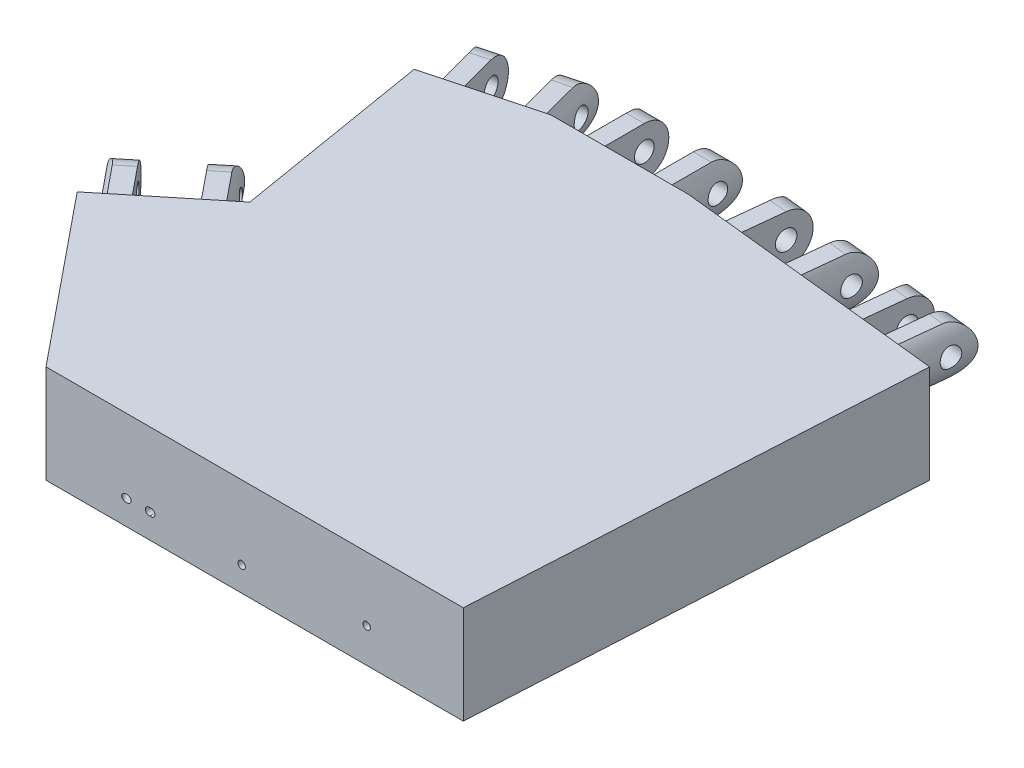
from build123d import *

# Parameters (mm, degrees)
BOSS_EXTRUDE1_DEPTH                 = 20
SKETCH2_W                           = 3.660254038
SKETCH2_H                           = 10
BOSS_EXTRUDE2_DEPTH                 = 15
CUT_EXTRUDE1_DEPTH                  = 114.0214199
CUT_EXTRUDE1_DEPTH_BACK             = 114.0214199
SKETCH3_R                           = 2
SKETCH7_W                           = 3.660254038
SKETCH7_H                           = 10
BOSS_EXTRUDE4_DEPTH                 = 15
CUT_EXTRUDE4_REACH                  = 103.066
CUT_EXTRUDE4_END_RADIUS             = 10
SKETCH8_R                           = 2
CUT_EXTRUDE4_DIRECTION_2_REACH      = 103.066
CUT_EXTRUDE4_DIRECTION_2_END_RADIUS = 10
SKETCH4_W                           = 3.660254038
SKETCH4_H                           = 10
SKETCH4_W_2                         = 3.090169943
SKETCH4_W_3                         = 3.090169944
BOSS_EXTRUDE3_DEPTH                 = 15
CUT_EXTRUDE3_START                  = -5
SKETCH6_R                           = 2
CUT_EXTRUDE3_DEPTH                  = 42.812004
SKETCH2_3_R                         = 0.75
CUT_EXTRUDE5_DEPTH                  = 123.192220688
SKETCH4_4_R                         = 0.75
CUT_EXTRUDE6_DEPTH                  = 115.031526432
SKETCH7_4_R                         = 0.75
CUT_EXTRUDE7_DEPTH                  = 113.041561779
BOSS_EXTRUDE5_DEPTH                 = 20
SKETCH10_W                          = 3.660254038
SKETCH10_H                          = 10
BOSS_EXTRUDE6_DEPTH                 = 15
SKETCH11_R                          = 2
CUT_EXTRUDE8_DEPTH                  = 7.707578
CUT_EXTRUDE8_DIRECTION_2_REACH      = 136.78
CUT_EXTRUDE8_DIRECTION_2_END_RADIUS = 10
SKETCH10_6_R                        = 0.75
CUT_EXTRUDE9_DEPTH                  = 104.391697718
CHAMFER1_SIZE                       = 2


with BuildPart() as part:
    # Sketch1 → Boss-Extrude1 (new body)
    with BuildSketch(Plane(origin=(0, 0, 0), x_dir=(1, 0, 0), z_dir=(0, 1, 0))):
        Polygon((-30.5, 50.866666667), (-52.5, 45), (-37.5, -45), (47.5, -45), (52.5, 45), (-2.5, 50.866666667), align=None)
    extrude(amount=BOSS_EXTRUDE1_DEPTH)

    # Sketch2 → Boss-Extrude2 (add)
    with BuildSketch(Plane(origin=(-14.68879668, 0, -55.082987552), x_dir=(-0.9662349396012465, 0, 0.25766265056033155), z_dir=(-0.25766265056033155, 0, -0.9662349396012465))):
        with Locations((20.302388035, 13)):
            Rectangle(SKETCH2_W, SKETCH2_H)
        with BuildLine():
            Line((18.472261016, 8), (18.472261016, 18))
            ThreePointArc((18.472261016, 18), (17.132515054, 13), (18.472261016, 8))
        make_face()
        with Locations((33.962642073, 13)):
            Rectangle(SKETCH2_W, SKETCH2_H)
        with BuildLine():
            ThreePointArc((37.132515054, 13), (36.791773317, 15.588190451), (35.792769092, 18))
            Line((35.792769092, 18), (35.792769092, 8))
            ThreePointArc((35.792769092, 8), (36.791773317, 10.411809549), (37.132515054, 13))
        make_face()
    extrude(amount=BOSS_EXTRUDE2_DEPTH)

    # Sketch3 → Cut-Extrude1 (cut, two sides: drawn at the far end of the back side and taken through both)
    with BuildSketch(Plane(origin=(-31.047558742, 0, 8.279348998), x_dir=(-0.25766265056033155, 0, -0.9662349396012465), z_dir=(0.9662349396012465, 0, -0.25766265056033155)).offset(-CUT_EXTRUDE1_DEPTH_BACK)):
        with BuildLine():
            Line((72.007861436, 18), (67.007861436, 18))
            ThreePointArc((67.007861436, 18), (70.543395342, 16.535533906), (72.007861436, 13))
            Line((72.007861436, 13), (72.007861436, 18))
        make_face()
        with BuildLine():
            Line((72.007861436, 8), (72.007861436, 13))
            ThreePointArc((72.007861436, 13), (70.543395342, 9.464466094), (67.007861436, 8))
            Line((67.007861436, 8), (72.007861436, 8))
        make_face()
        with Locations((67.007861436, 13)):
            Circle(SKETCH3_R)
    extrude(amount=CUT_EXTRUDE1_DEPTH + CUT_EXTRUDE1_DEPTH_BACK, mode=Mode.SUBTRACT)

    # Sketch7 → Boss-Extrude4 (add)
    with BuildSketch(Plane(origin=(0, 0, -50.866666667), x_dir=(-1, 0, 0), z_dir=(0, 0, -1))):
        with Locations((23.330127019, 13)):
            Rectangle(SKETCH7_W, SKETCH7_H)
        with Locations((9.669872981, 13)):
            Rectangle(SKETCH7_W, SKETCH7_H)
        with BuildLine():
            Line((7.839745962, 8), (7.839745962, 18))
            ThreePointArc((7.839745962, 18), (6.5, 13), (7.839745962, 8))
        make_face()
        with BuildLine():
            ThreePointArc((26.5, 13), (26.159258263, 15.588190451), (25.160254038, 18))
            Line((25.160254038, 18), (25.160254038, 8))
            ThreePointArc((25.160254038, 8), (26.159258263, 10.411809549), (26.5, 13))
        make_face()
    extrude(amount=BOSS_EXTRUDE4_DEPTH)

    # Cut-Extrude4: up to this cylinder (the profile starts inside it)
    cut_extrude4_end = Plane(origin=(-16.5, 13, -62.808247), z_dir=(0, 0, 1)) * Cylinder(CUT_EXTRUDE4_END_RADIUS, 231.01516, mode=Mode.PRIVATE)
    # Sketch8 → Cut-Extrude4 (cut, up to the surface)
    with BuildSketch(Plane(origin=(-21.5, 0, 0), x_dir=(0, 0, -1), z_dir=(1, 0, 0)), mode=Mode.PRIVATE) as cut_extrude4_sk1:
        with BuildLine():
            Line((65.866666667, 18), (60.866666667, 18))
            ThreePointArc((60.866666667, 18), (64.402200573, 16.535533906), (65.866666667, 13))
            Line((65.866666667, 13), (65.866666667, 18))
        make_face()
    cut_extrude4_tool1 = extrude(cut_extrude4_sk1.sketch, amount=CUT_EXTRUDE4_REACH, mode=Mode.PRIVATE) & cut_extrude4_end
    add(cut_extrude4_tool1.solids().sort_by_distance((-21.5, 16.88316, -64.749827))[0], mode=Mode.SUBTRACT)
    # Sketch8 → Cut-Extrude4 (cut, up to the surface)
    with BuildSketch(Plane(origin=(-21.5, 0, 0), x_dir=(0, 0, -1), z_dir=(1, 0, 0)), mode=Mode.PRIVATE) as cut_extrude4_sk2:
        with BuildLine():
            Line((65.866666667, 8), (65.866666667, 13))
            ThreePointArc((65.866666667, 13), (64.402200573, 9.464466094), (60.866666667, 8))
            Line((60.866666667, 8), (65.866666667, 8))
        make_face()
    cut_extrude4_tool2 = extrude(cut_extrude4_sk2.sketch, amount=CUT_EXTRUDE4_REACH, mode=Mode.PRIVATE) & cut_extrude4_end
    add(cut_extrude4_tool2.solids().sort_by_distance((-21.5, 9.11684, -64.749827))[0], mode=Mode.SUBTRACT)
    # Sketch8 → Cut-Extrude4 (cut, up to the surface)
    with BuildSketch(Plane(origin=(-21.5, 0, 0), x_dir=(0, 0, -1), z_dir=(1, 0, 0)), mode=Mode.PRIVATE) as cut_extrude4_sk3:
        with Locations(Location((60.866666667, 13, 0), (0, 0, 180))):
            Circle(SKETCH8_R)
    cut_extrude4_tool3 = extrude(cut_extrude4_sk3.sketch, amount=CUT_EXTRUDE4_REACH, mode=Mode.PRIVATE) & cut_extrude4_end
    add(cut_extrude4_tool3.solids().sort_by_distance((-21.5, 13, -60.866667))[0], mode=Mode.SUBTRACT)

    # Cut-Extrude4 direction 2: up to this cylinder (the profile starts inside it)
    cut_extrude4_direction_2_end = Plane(origin=(-16.5, 13, -62.808247), z_dir=(0, 0, 1)) * Cylinder(CUT_EXTRUDE4_DIRECTION_2_END_RADIUS, 231.01516, mode=Mode.PRIVATE)
    # Sketch8 → Cut-Extrude4 direction 2 (cut, up to the surface)
    with BuildSketch(Plane(origin=(-21.5, 0, 0), x_dir=(0, 0, -1), z_dir=(1, 0, 0)), mode=Mode.PRIVATE) as cut_extrude4_direction_2_sk1:
        with BuildLine():
            Line((65.866666667, 18), (60.866666667, 18))
            ThreePointArc((60.866666667, 18), (64.402200573, 16.535533906), (65.866666667, 13))
            Line((65.866666667, 13), (65.866666667, 18))
        make_face()
    cut_extrude4_direction_2_tool1 = extrude(cut_extrude4_direction_2_sk1.sketch, amount=-CUT_EXTRUDE4_DIRECTION_2_REACH, mode=Mode.PRIVATE) & cut_extrude4_direction_2_end
    add(cut_extrude4_direction_2_tool1.solids().sort_by_distance((-21.5, 16.88316, -64.749827))[0], mode=Mode.SUBTRACT)
    # Sketch8 → Cut-Extrude4 direction 2 (cut, up to the surface)
    with BuildSketch(Plane(origin=(-21.5, 0, 0), x_dir=(0, 0, -1), z_dir=(1, 0, 0)), mode=Mode.PRIVATE) as cut_extrude4_direction_2_sk2:
        with BuildLine():
            Line((65.866666667, 8), (65.866666667, 13))
            ThreePointArc((65.866666667, 13), (64.402200573, 9.464466094), (60.866666667, 8))
            Line((60.866666667, 8), (65.866666667, 8))
        make_face()
    cut_extrude4_direction_2_tool2 = extrude(cut_extrude4_direction_2_sk2.sketch, amount=-CUT_EXTRUDE4_DIRECTION_2_REACH, mode=Mode.PRIVATE) & cut_extrude4_direction_2_end
    add(cut_extrude4_direction_2_tool2.solids().sort_by_distance((-21.5, 9.11684, -64.749827))[0], mode=Mode.SUBTRACT)
    # Sketch8 → Cut-Extrude4 direction 2 (cut, up to the surface)
    with BuildSketch(Plane(origin=(-21.5, 0, 0), x_dir=(0, 0, -1), z_dir=(1, 0, 0)), mode=Mode.PRIVATE) as cut_extrude4_direction_2_sk3:
        with Locations(Location((60.866666667, 13, 0), (0, 0, 180))):
            Circle(SKETCH8_R)
    cut_extrude4_direction_2_tool3 = extrude(cut_extrude4_direction_2_sk3.sketch, amount=-CUT_EXTRUDE4_DIRECTION_2_REACH, mode=Mode.PRIVATE) & cut_extrude4_direction_2_end
    add(cut_extrude4_direction_2_tool3.solids().sort_by_distance((-21.5, 13, -60.866667))[0], mode=Mode.SUBTRACT)

    # Sketch4 → Boss-Extrude3 (add)
    with BuildSketch(Plane(origin=(5.336614519, 0, -50.030761118), x_dir=(-0.994359200551929, 0, -0.10606498139220541), z_dir=(0.10606498139220541, 0, -0.994359200551929))):
        with BuildLine():
            ThreePointArc((2.881070055, 13), (2.540328318, 15.588190451), (1.541324093, 18))
            Line((1.541324093, 18), (1.541324093, 8))
            ThreePointArc((1.541324093, 8), (2.540328318, 10.411809549), (2.881070055, 13))
        make_face()
        with Locations((-0.288802926, 13)):
            Rectangle(SKETCH4_W, SKETCH4_H)
        with Locations((-13.949056964, 13)):
            Rectangle(SKETCH4_W, SKETCH4_H)
        with BuildLine():
            Line((-15.779183983, 8), (-15.779183983, 18))
            ThreePointArc((-15.779183983, 18), (-17.118929945, 13), (-15.779183983, 8))
        make_face()
        with Locations((-28.385848895, 13)):
            Rectangle(SKETCH4_W_2, SKETCH4_H)
        with BuildLine():
            ThreePointArc((-24.930933866, 13), (-25.424641174, 15.676165673), (-26.840763923, 18))
            Line((-26.840763923, 18), (-26.840763923, 8))
            ThreePointArc((-26.840763923, 8), (-25.424641174, 10.323834327), (-24.930933866, 13))
        make_face()
        with Locations((-36.476018838, 13)):
            Rectangle(SKETCH4_W_3, SKETCH4_H)
        with BuildLine():
            Line((-38.02110381, 8), (-38.02110381, 18))
            ThreePointArc((-38.02110381, 18), (-39.930933866, 13), (-38.02110381, 8))
        make_face()
    extrude(amount=BOSS_EXTRUDE3_DEPTH)

    # Sketch6 → Cut-Extrude3 (cut)
    with BuildSketch(Plane(origin=(2.106977486, 0, 0.224744265), x_dir=(0.10606498139220541, 0, -0.994359200551929), z_dir=(0.994359200551929, 0, 0.10606498139220541)).offset(CUT_EXTRUDE3_START)):
        with BuildLine():
            Line((65.314575548, 18), (60.314575548, 18))
            ThreePointArc((60.314575548, 18), (63.850109454, 16.535533906), (65.314575548, 13))
            Line((65.314575548, 13), (65.314575548, 18))
        make_face()
        with BuildLine():
            Line((65.314575548, 8), (65.314575548, 13))
            ThreePointArc((65.314575548, 13), (63.850109454, 9.464466094), (60.314575548, 8))
            Line((60.314575548, 8), (65.314575548, 8))
        make_face()
        with Locations((60.314575548, 13)):
            Circle(SKETCH6_R)
    extrude(amount=CUT_EXTRUDE3_DEPTH, mode=Mode.SUBTRACT)

    # Sketch2<3> → Cut-Extrude5 (cut, through all)
    with BuildSketch(Plane(origin=(-14.68879668, 0, -55.082987552), x_dir=(-0.9662349396012465, 0, 0.25766265056033155), z_dir=(-0.25766265056033155, 0, -0.9662349396012465))):
        with Locations((27.132515054, 5)):
            Circle(SKETCH2_3_R)
    extrude(amount=-CUT_EXTRUDE5_DEPTH, mode=Mode.SUBTRACT)

    # Sketch4<4> → Cut-Extrude6 (cut, through all)
    with BuildSketch(Plane(origin=(5.336614519, 0, -50.030761118), x_dir=(-0.994359200551929, 0, -0.10606498139220541), z_dir=(0.10606498139220541, 0, -0.994359200551929))):
        with Locations((-32.430933866, 7)):
            Circle(SKETCH4_4_R)
        with Locations((-7.118929945, 5)):
            Circle(SKETCH4_4_R)
    extrude(amount=-CUT_EXTRUDE6_DEPTH, mode=Mode.SUBTRACT)

    # Sketch7<4> → Cut-Extrude7 (cut, through all)
    with BuildSketch(Plane(origin=(0, 0, -50.866666667), x_dir=(-1, 0, 0), z_dir=(0, 0, -1))):
        with Locations((16.5, 5)):
            Circle(SKETCH7_4_R)
    extrude(amount=-CUT_EXTRUDE7_DEPTH, mode=Mode.SUBTRACT)

    # Sketch9 → Boss-Extrude5 (add)
    with BuildSketch(Plane(origin=(0, 20, 0), x_dir=(1, 0, 0), z_dir=(0, 1, 0))):
        Polygon((-45.804438658, 4.82663195), (-65.198349508, -10.949179342), (-37.5, -45), align=None)
    extrude(amount=-BOSS_EXTRUDE5_DEPTH)

    # Sketch10 → Boss-Extrude6 (add)
    with BuildSketch(Plane(origin=(-20.602186024, 0, -25.327189305), x_dir=(-0.7757564339996801, 0, 0.6310324517075965), z_dir=(-0.6310324517075965, 0, -0.7757564339996801))):
        with Locations((37.94962147, 13)):
            Rectangle(SKETCH10_W, SKETCH10_H)
        with BuildLine():
            Line((36.119494451, 8), (36.119494451, 18))
            ThreePointArc((36.119494451, 18), (34.779748489, 13), (36.119494451, 8))
        make_face()
        with BuildLine():
            ThreePointArc((54.779748489, 13), (54.439006752, 15.588190451), (53.440002527, 18))
            Line((53.440002527, 18), (53.440002527, 8))
            ThreePointArc((53.440002527, 8), (54.439006752, 10.411809549), (54.779748489, 13))
        make_face()
        with Locations((51.609875508, 13)):
            Rectangle(SKETCH10_W, SKETCH10_H)
    extrude(amount=BOSS_EXTRUDE6_DEPTH)

    # Sketch11 → Cut-Extrude8 (cut)
    with BuildSketch(Plane(origin=(-38.616960173, 0, 31.412636734), x_dir=(-0.6310324517075965, 0, -0.7757564339996801), z_dir=(0.7757564339996801, 0, -0.6310324517075965))):
        with BuildLine():
            Line((47.648378016, 18), (42.648378016, 18))
            ThreePointArc((42.648378016, 18), (46.183911922, 16.535533906), (47.648378016, 13))
            Line((47.648378016, 13), (47.648378016, 18))
        make_face()
        with BuildLine():
            Line((47.648378016, 8), (47.648378016, 13))
            ThreePointArc((47.648378016, 13), (46.183911922, 9.464466094), (42.648378016, 8))
            Line((42.648378016, 8), (47.648378016, 8))
        make_face()
        with Locations((42.648378016, 13)):
            Circle(SKETCH11_R)
    extrude(amount=-CUT_EXTRUDE8_DEPTH, mode=Mode.SUBTRACT)

    # Cut-Extrude8 direction 2: up to this cylinder (the profile starts inside it)
    cut_extrude8_direction_2_end = Plane(origin=(-62.875888852, 13, -6.333472741), z_dir=(0.6310324517075965, 0, 0.7757564339996801)) * Cylinder(CUT_EXTRUDE8_DIRECTION_2_END_RADIUS, 298.443160517, mode=Mode.PRIVATE)
    # Sketch11 → Cut-Extrude8 direction 2 (cut, up to the surface)
    with BuildSketch(Plane(origin=(-38.616960173, 0, 31.412636734), x_dir=(-0.6310324517075965, 0, -0.7757564339996801), z_dir=(0.7757564339996801, 0, -0.6310324517075965)), mode=Mode.PRIVATE) as cut_extrude8_direction_2_sk1:
        with BuildLine():
            Line((47.648378016, 18), (42.648378016, 18))
            ThreePointArc((42.648378016, 18), (46.183911922, 16.535533906), (47.648378016, 13))
            Line((47.648378016, 13), (47.648378016, 18))
        make_face()
    cut_extrude8_direction_2_tool1 = extrude(cut_extrude8_direction_2_sk1.sketch, amount=CUT_EXTRUDE8_DIRECTION_2_REACH, mode=Mode.PRIVATE) & cut_extrude8_direction_2_end
    add(cut_extrude8_direction_2_tool1.solids().sort_by_distance((-67.979871, 16.88316, -4.684504))[0], mode=Mode.SUBTRACT)
    # Sketch11 → Cut-Extrude8 direction 2 (cut, up to the surface)
    with BuildSketch(Plane(origin=(-38.616960173, 0, 31.412636734), x_dir=(-0.6310324517075965, 0, -0.7757564339996801), z_dir=(0.7757564339996801, 0, -0.6310324517075965)), mode=Mode.PRIVATE) as cut_extrude8_direction_2_sk2:
        with BuildLine():
            Line((47.648378016, 8), (47.648378016, 13))
            ThreePointArc((47.648378016, 13), (46.183911922, 9.464466094), (42.648378016, 8))
            Line((42.648378016, 8), (47.648378016, 8))
        make_face()
    cut_extrude8_direction_2_tool2 = extrude(cut_extrude8_direction_2_sk2.sketch, amount=CUT_EXTRUDE8_DIRECTION_2_REACH, mode=Mode.PRIVATE) & cut_extrude8_direction_2_end
    add(cut_extrude8_direction_2_tool2.solids().sort_by_distance((-67.979871, 9.11684, -4.684504))[0], mode=Mode.SUBTRACT)
    # Sketch11 → Cut-Extrude8 direction 2 (cut, up to the surface)
    with BuildSketch(Plane(origin=(-38.616960173, 0, 31.412636734), x_dir=(-0.6310324517075965, 0, -0.7757564339996801), z_dir=(0.7757564339996801, 0, -0.6310324517075965)), mode=Mode.PRIVATE) as cut_extrude8_direction_2_sk3:
        with Locations((42.648378016, 13)):
            Circle(SKETCH11_R)
    cut_extrude8_direction_2_tool3 = extrude(cut_extrude8_direction_2_sk3.sketch, amount=CUT_EXTRUDE8_DIRECTION_2_REACH, mode=Mode.PRIVATE) & cut_extrude8_direction_2_end
    add(cut_extrude8_direction_2_tool3.solids().sort_by_distance((-65.529471, 13, -1.672117))[0], mode=Mode.SUBTRACT)

    # Sketch10<6> → Cut-Extrude9 (cut, through all)
    with BuildSketch(Plane(origin=(-20.602186024, 0, -25.327189305), x_dir=(-0.7757564339996801, 0, 0.6310324517075965), z_dir=(-0.6310324517075965, 0, -0.7757564339996801))):
        with Locations((44.779748489, 5)):
            Circle(SKETCH10_6_R)
    extrude(amount=-CUT_EXTRUDE9_DEPTH, mode=Mode.SUBTRACT)

    # Chamfer1
    # the kernel refuses this chamfer: 2 mm, written as the material it takes off along each edge
    with BuildSketch(Plane(origin=(-40.905180725, 5, -48.091951807), x_dir=(-0.9662349396012476, 0, 0.25766265056032767), z_dir=(0, -1, 0))) as chamfer1_piece_1:
        Polygon((0.75 + CHAMFER1_SIZE, 0), (0.75, -CHAMFER1_SIZE), (0.75, 0), align=None)
    revolve(axis=Axis((-40.905180725, 5, -48.091951807), (-0.25766265056033155, 0, -0.9662349396012465)), mode=Mode.SUBTRACT)
    with BuildSketch(Plane(origin=(37.584611992, 7, -46.590974721), x_dir=(-0.9943592005519292, 0, -0.10606498139220338), z_dir=(0, -1, 0))) as chamfer1_piece_2_section:
        Polygon((0.75 + CHAMFER1_SIZE, 0), (0.75, -CHAMFER1_SIZE), (0.75, 0), align=None)
    chamfer1_piece_2 = revolve(axis=Axis((37.584611992, 7, -46.590974721), (0.10606498139220541, 0, -0.994359200551929)), mode=Mode.PRIVATE)
    chamfer1_piece_2 = split(chamfer1_piece_2, bisect_by=Plane(origin=(34.99978033, 8, -46.855853718), z_dir=(0, -1, 0)), keep=Keep.TOP, mode=Mode.PRIVATE)
    chamfer1_piece_2 = split(chamfer1_piece_2, bisect_by=Plane(origin=(35.097571113, 6.981657325, -46.845422701), z_dir=(-0.994359200551929, 0, -0.10606498139220541)), keep=Keep.TOP, mode=Mode.PRIVATE)
    add(chamfer1_piece_2, mode=Mode.SUBTRACT)
    with BuildSketch(Plane(origin=(37.584611992, 7, -46.590974721), x_dir=(-0.9943592005519292, 0, -0.10606498139220338), z_dir=(0, -1, 0))) as chamfer1_piece_3_section:
        Polygon((0.75 + CHAMFER1_SIZE, 0), (0.75, -CHAMFER1_SIZE), (0.75, 0), align=None)
    chamfer1_piece_3 = revolve(axis=Axis((37.584611992, 7, -46.590974721), (0.10606498139220541, 0, -0.994359200551929)), mode=Mode.PRIVATE)
    chamfer1_piece_3 = split(chamfer1_piece_3, bisect_by=Plane(origin=(39.203264891, 8, -45.430092696), z_dir=(0, -1, 0)), keep=Keep.TOP, mode=Mode.PRIVATE)
    chamfer1_piece_3 = split(chamfer1_piece_3, bisect_by=Plane(origin=(39.966285098, 7, -45.348703874), z_dir=(-0.994359200551929, 0, -0.10606498139220541)), keep=Keep.TOP, mode=Mode.PRIVATE)
    chamfer1_piece_3 = split(chamfer1_piece_3, bisect_by=Plane(origin=(34.994489095, 7, -45.87902878), z_dir=(0.994359200551929, 0, 0.10606498139220541)), keep=Keep.TOP, mode=Mode.PRIVATE)
    add(chamfer1_piece_3, mode=Mode.SUBTRACT)
    with BuildSketch(Plane(origin=(37.584611992, 7, -46.590974721), x_dir=(-0.9943592005519292, 0, -0.10606498139220338), z_dir=(0, -1, 0))) as chamfer1_piece_4_section:
        Polygon((0.75 + CHAMFER1_SIZE, 0), (0.75, -CHAMFER1_SIZE), (0.75, 0), align=None)
    chamfer1_piece_4 = revolve(axis=Axis((37.584611992, 7, -46.590974721), (0.10606498139220541, 0, -0.994359200551929)), mode=Mode.PRIVATE)
    chamfer1_piece_4 = split(chamfer1_piece_4, bisect_by=Plane(origin=(40.16715802, 8, -46.304666836), z_dir=(0, -1, 0)), keep=Keep.TOP, mode=Mode.PRIVATE)
    chamfer1_piece_4 = split(chamfer1_piece_4, bisect_by=Plane(origin=(40.069367123, 6.981656533, -46.315097865), z_dir=(0.994359200551929, 0, 0.10606498139220541)), keep=Keep.TOP, mode=Mode.PRIVATE)
    add(chamfer1_piece_4, mode=Mode.SUBTRACT)
    with BuildSketch(Plane(origin=(37.584611992, 7, -46.590974721), x_dir=(-0.9943592005519292, 0, -0.10606498139220338), z_dir=(0, -1, 0))) as chamfer1_piece_5_section:
        Polygon((0.75 + CHAMFER1_SIZE, 0), (0.75, -CHAMFER1_SIZE), (0.75, 0), align=None)
    chamfer1_piece_5 = revolve(axis=Axis((37.584611992, 7, -46.590974721), (0.10606498139220541, 0, -0.994359200551929)), mode=Mode.PRIVATE)
    chamfer1_piece_5 = split(chamfer1_piece_5, bisect_by=Plane(origin=(37.539060076, 8, -46.163924967), z_dir=(0, 1, 0)), keep=Keep.TOP, mode=Mode.PRIVATE)
    chamfer1_piece_5 = split(chamfer1_piece_5, bisect_by=Plane(origin=(40.02495802, 8.55271056, -45.89876252), z_dir=(-0.994359200551929, 0, -0.10606498139220541)), keep=Keep.TOP, mode=Mode.PRIVATE)
    chamfer1_piece_5 = split(chamfer1_piece_5, bisect_by=Plane(origin=(35.053162017, 8.55271056, -46.429087427), z_dir=(0.994359200551929, 0, 0.10606498139220541)), keep=Keep.TOP, mode=Mode.PRIVATE)
    add(chamfer1_piece_5, mode=Mode.SUBTRACT)
    with BuildSketch(Plane(origin=(12.415388008, 5, -49.275691946), x_dir=(-0.9943592005519291, 0, -0.10606498139220362), z_dir=(0, -1, 0))) as chamfer1_piece_6:
        Polygon((0.75 + CHAMFER1_SIZE, 0), (0.75, -CHAMFER1_SIZE), (0.75, 0), align=None)
    revolve(axis=Axis((12.415388008, 5, -49.275691946), (0.10606498139220541, 0, -0.994359200551929)), mode=Mode.SUBTRACT)
    with BuildSketch(Plane(origin=(-16.5, 5, -50.866666667), x_dir=(-1, 0, 0), z_dir=(0, -1, 0))) as chamfer1_piece_7:
        Polygon((0.75 + CHAMFER1_SIZE, 0), (0.75, -CHAMFER1_SIZE), (0.75, 0), align=None)
    revolve(axis=Axis((-16.5, 5, -50.866666667), (0, 0, -1)), mode=Mode.SUBTRACT)
    with BuildSketch(Plane(origin=(-55.340364027, 5, 2.93028517), x_dir=(-0.7757564339996815, 0, 0.6310324517075947), z_dir=(0, -1, 0))) as chamfer1_piece_8:
        Polygon((0.75 + CHAMFER1_SIZE, 0), (0.75, -CHAMFER1_SIZE), (0.75, 0), align=None)
    revolve(axis=Axis((-55.340364027, 5, 2.93028517), (-0.6310324517075965, 0, -0.7757564339996801)), mode=Mode.SUBTRACT)


solid = part.part
